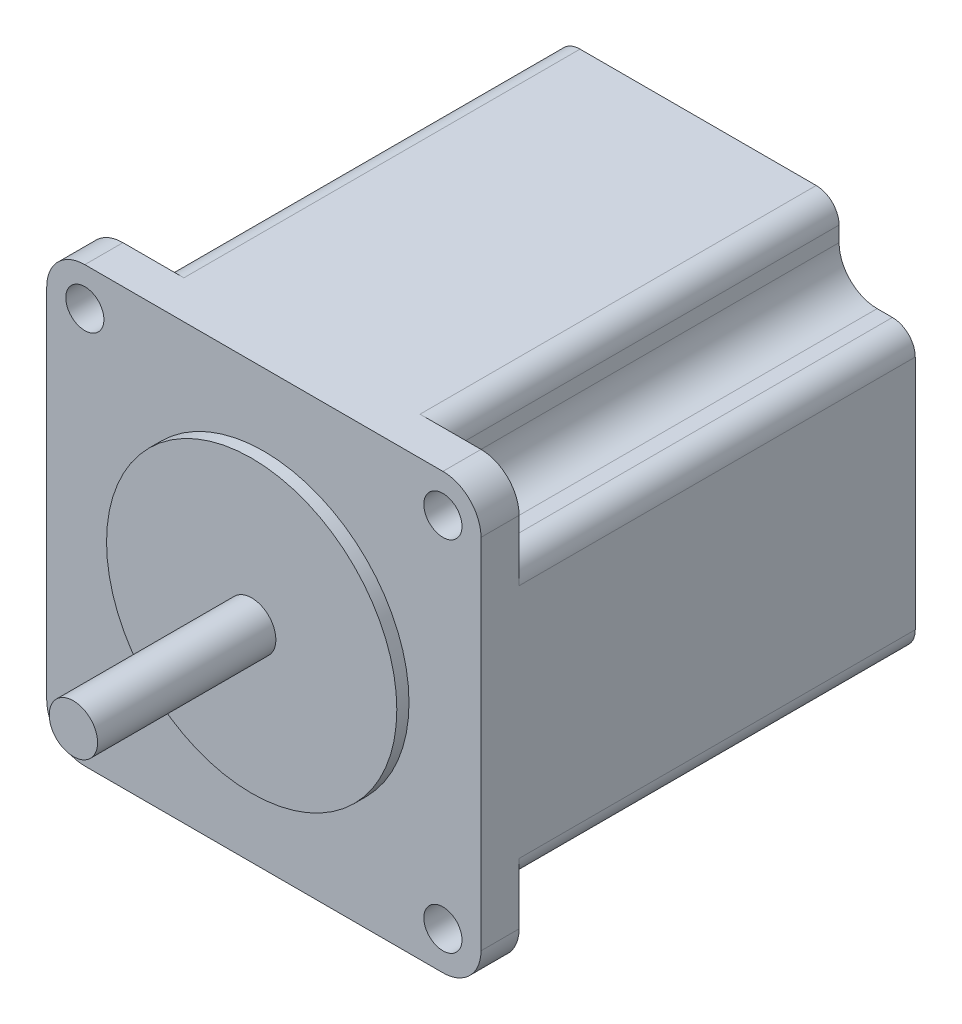
from build123d import *

# Parameters (mm, degrees)
SKETCH1_R           = 2.5
BOSS_EXTRUDE1_DEPTH = 2.5
SKETCH2_R           = 3.175
BOSS_EXTRUDE2_DEPTH = 25
SKETCH3_R           = 19.05
BOSS_EXTRUDE3_DEPTH = 1.6
BOSS_EXTRUDE4_DEPTH = 52


with BuildPart() as part:
    # Sketch1 → Boss-Extrude1 (new, symmetric)
    with BuildSketch(Plane.XY):
        with BuildLine():
            Line((-23.5, -28.5), (23.5, -28.5))
            ThreePointArc((23.5, -28.5), (27.035533906, -27.035533906), (28.5, -23.5))
            Line((28.5, -23.5), (28.5, 23.5))
            ThreePointArc((28.5, 23.5), (27.035533906, 27.035533906), (23.5, 28.5))
            Line((23.5, 28.5), (-23.5, 28.5))
            ThreePointArc((-23.5, 28.5), (-27.035533906, 27.035533906), (-28.5, 23.5))
            Line((-28.5, 23.5), (-28.5, -23.5))
            ThreePointArc((-28.5, -23.5), (-27.035533906, -27.035533906), (-23.5, -28.5))
        make_face()
        with Locations((-23.5, 23.5)):
            Circle(SKETCH1_R, mode=Mode.SUBTRACT)
        with Locations((23.5, 23.5)):
            Circle(SKETCH1_R, mode=Mode.SUBTRACT)
        with Locations((23.5, -23.5)):
            Circle(SKETCH1_R, mode=Mode.SUBTRACT)
        with Locations((-23.57, -23.57)):
            Circle(SKETCH1_R, mode=Mode.SUBTRACT)
    extrude(amount=BOSS_EXTRUDE1_DEPTH, both=True)

    # Sketch2 → Boss-Extrude2 (add)
    with BuildSketch(Plane.XY.offset(2.5)):
        Circle(SKETCH2_R)
    extrude(amount=BOSS_EXTRUDE2_DEPTH)

    # Sketch3 → Boss-Extrude3 (add)
    with BuildSketch(Plane.XY.offset(2.5)):
        Circle(SKETCH3_R)
    extrude(amount=BOSS_EXTRUDE3_DEPTH)

    # Sketch4 → Boss-Extrude4 (add)
    with BuildSketch(Plane(origin=(0, 0, -2.5), x_dir=(-1, 0, 0), z_dir=(0, 0, -1))):
        with BuildLine():
            Line((-18.5, 23.5), (-18.5, 25.5))
            ThreePointArc((-18.5, 25.5), (-17.621320344, 27.621320344), (-15.5, 28.5))
            Line((-15.5, 28.5), (15.5, 28.5))
            ThreePointArc((15.5, 28.5), (17.621320344, 27.621320344), (18.5, 25.5))
            Line((18.5, 25.5), (18.5, 23.5))
            ThreePointArc((18.5, 23.5), (19.964466094, 19.964466094), (23.5, 18.5))
            Line((23.5, 18.5), (25.5, 18.5))
            ThreePointArc((25.5, 18.5), (27.621320344, 17.621320344), (28.5, 15.5))
            Line((28.5, 15.5), (28.5, -15.57))
            ThreePointArc((28.5, -15.57), (27.621320344, -17.691320344), (25.5, -18.57))
            Line((25.5, -18.57), (23.57, -18.57))
            ThreePointArc((23.57, -18.57), (20.034466094, -20.034466094), (18.57, -23.57))
            Line((18.57, -23.57), (18.57, -25.5))
            ThreePointArc((18.57, -25.5), (17.691320344, -27.621320344), (15.57, -28.5))
            Line((15.57, -28.5), (-15.5, -28.5))
            ThreePointArc((-15.5, -28.5), (-17.621320344, -27.621320344), (-18.5, -25.5))
            Line((-18.5, -25.5), (-18.5, -23.5))
            ThreePointArc((-18.5, -23.5), (-19.964466094, -19.964466094), (-23.5, -18.5))
            Line((-23.5, -18.5), (-25.5, -18.5))
            ThreePointArc((-25.5, -18.5), (-27.621320344, -17.621320344), (-28.5, -15.5))
            Line((-28.5, -15.5), (-28.5, 15.5))
            ThreePointArc((-28.5, 15.5), (-27.621320344, 17.621320344), (-25.5, 18.5))
            Line((-25.5, 18.5), (-23.5, 18.5))
            ThreePointArc((-23.5, 18.5), (-19.964466094, 19.964466094), (-18.5, 23.5))
        make_face()
    extrude(amount=BOSS_EXTRUDE4_DEPTH)


solid = part.part
